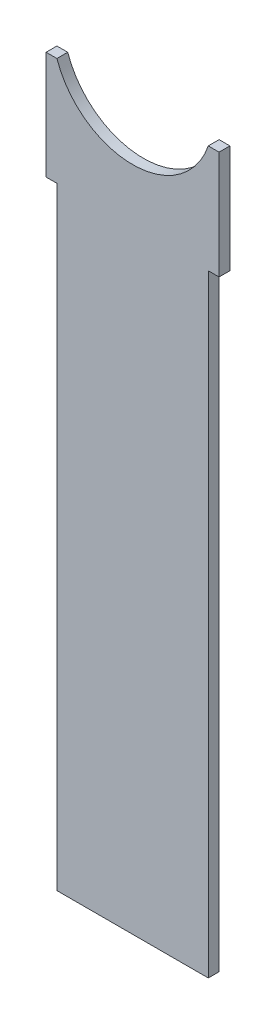
from build123d import *

# Parameters (mm, degrees)
BOSS_EXTRUDE1_DEPTH = 1.5875


with BuildPart() as part:
    # Sketch2 → Boss-Extrude1 (new body)
    with BuildSketch(Plane.XY):
        with BuildLine():
            Line((-12.7, 0), (-12.7, -15.875))
            Line((-12.7, -15.875), (-11.1125, -15.875))
            Line((-11.1125, -15.875), (-11.1125, -105.804584263))
            Line((-11.1125, -105.804584263), (11.1125, -105.804584263))
            Line((11.1125, -105.804584263), (11.1125, -15.875))
            Line((11.1125, -15.875), (12.7, -15.875))
            Line((12.7, -15.875), (12.7, 0))
            Line((12.7, 0), (11.1125, 0))
            ThreePointArc((11.1125, 0), (0, -7.9375), (-11.1125, 0))
            Line((-11.1125, 0), (-12.7, 0))
        make_face()
    extrude(amount=BOSS_EXTRUDE1_DEPTH)


solid = part.part
